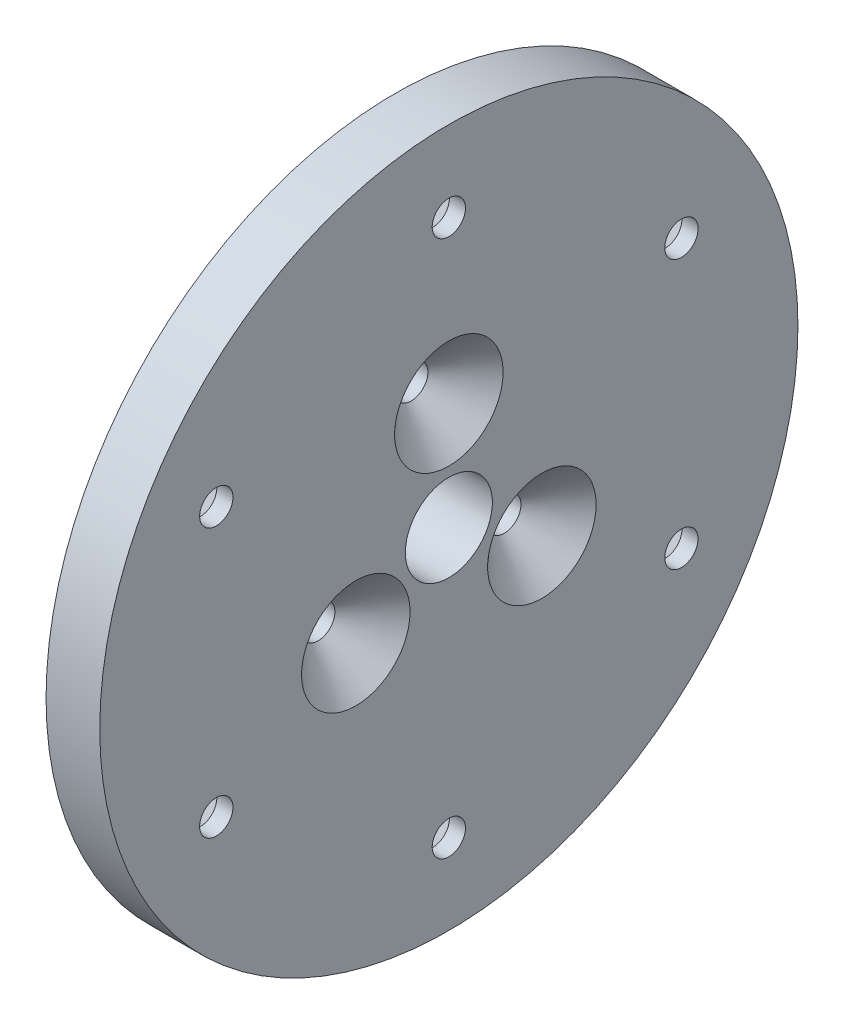
from build123d import *

# Parameters (mm, degrees)
F_8_1_8_1_DURCHMESSER_BOHRUNG1_D = 8.1
SKIZZE4_R                        = 1.55
SCHNITT_LINEAR_AUSTRAGEN1_DEPTH  = 47.652974182
FASE1_SIZE                       = 3.5
SKIZZE5_R                        = 1.55
SCHNITT_LINEAR_AUSTRAGEN2_DEPTH  = 47.652974182
FASE2_SIZE                       = 3.5


with BuildPart() as part:
    # Skizze1 → Rotation1 (revolve)
    with BuildSketch(Plane.XY):
        Polygon((0, 0), (0, 17.25), (3, 17.25), (3, 32.5), (8, 32.5), (8, 0), align=None)
    revolve(axis=Axis((0, 0, 0), (-1, 0, 0)))

    # Ø8.1 (8.1) Durchmesser Bohrung1 (through all)
    with Locations(Plane.ZY):
        with Locations((0, 0)):
            Hole(F_8_1_8_1_DURCHMESSER_BOHRUNG1_D / 2)

    # Skizze4 → Schnitt-Linear austragen1 (cut, through all)
    with BuildSketch(Plane(origin=(8, 0, 0), x_dir=(0, 0, -1), z_dir=(1, 0, 0))):
        with Locations((0, 10)):
            Circle(SKIZZE4_R)
        with Locations((8.660254038, -5)):
            Circle(SKIZZE4_R)
        with Locations((-8.660254038, -5)):
            Circle(SKIZZE4_R)
    extrude(amount=-SCHNITT_LINEAR_AUSTRAGEN1_DEPTH, mode=Mode.SUBTRACT)

    # Fase1
    fase1_edges = [part.edges().sort_by_distance(p)[0] for p in [
        (8, -5, -7.110254038),
        (8, -5, 10.210254038),
        (8, 10, 1.55),
    ]]
    chamfer(fase1_edges, length=FASE1_SIZE)

    # Skizze5 → Schnitt-Linear austragen2 (cut, through all)
    with BuildSketch(Plane(origin=(8, 0, 0), x_dir=(0, 0, -1), z_dir=(1, 0, 0))):
        with Locations((0, 25)):
            Circle(SKIZZE5_R)
        with Locations((21.650635095, 12.5)):
            Circle(SKIZZE5_R)
        with Locations((21.650635095, -12.5)):
            Circle(SKIZZE5_R)
        with Locations((0, -25)):
            Circle(SKIZZE5_R)
        with Locations((-21.650635095, -12.5)):
            Circle(SKIZZE5_R)
        with Locations((-21.650635095, 12.5)):
            Circle(SKIZZE5_R)
    extrude(amount=-SCHNITT_LINEAR_AUSTRAGEN2_DEPTH, mode=Mode.SUBTRACT)

    # Fase2
    fase2_edges = [part.edges().sort_by_distance(p)[0] for p in [
        (3, -12.5, -20.100635095),
        (3, -25, 1.55),
        (3, -12.5, 23.200635095),
        (3, 12.5, 23.200635095),
        (3, 25, 1.55),
        (3, 12.5, -20.100635095),
    ]]
    chamfer(fase2_edges, length=FASE2_SIZE)


solid = part.part
